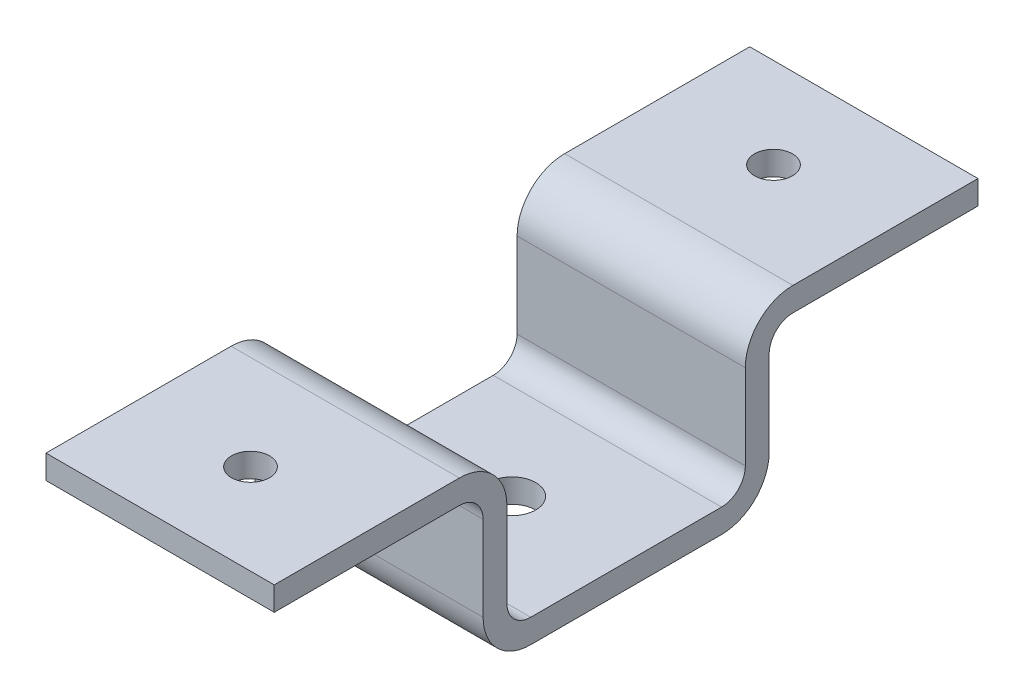
from build123d import *

# Parameters (mm, degrees)
BOSS_EXTRUDE3_START = -76.2
BOSS_EXTRUDE3_DEPTH = 76.2
SKETCH3_R           = 7.9375
CUT_EXTRUDE1_DEPTH  = 76.2
SKETCH2_R           = 6.35
CUT_EXTRUDE3_DEPTH  = 76.2


# Read off the part's stored shape, not the designer's step: Boss-Extrude3
with BuildPart() as part:
    # Boss-Extrude3 outline → Boss-Extrude3 (new body)
    with BuildSketch(Plane.YZ.offset(BOSS_EXTRUDE3_START)):
        with BuildLine():
            Line((44.228000004, 47.750520151), (15.875, 47.750520151))
            ThreePointArc((15.875, 47.750520151), (4.649679848, 43.100840303), (0, 31.875520151))
            Line((0, 31.875520151), (0, -31.875520151))
            ThreePointArc((0, -31.875520151), (4.649679849, -43.100840302), (15.875, -47.750520151))
            Line((15.875, -47.750520151), (44.228000004, -47.750520151))
            ThreePointArc((44.228000004, -47.750520151), (49.849640336, -50.079079819), (52.178200004, -55.700720151))
            Line((52.178200004, -55.700720151), (52.178200004, -117.475))
            Line((52.178200004, -117.475), (60.128400004, -117.475))
            Line((60.128400004, -117.475), (60.128400004, -55.675320151))
            ThreePointArc((60.128400004, -55.675320151), (55.478720155, -44.45), (44.253400004, -39.800320151))
            Line((44.253400004, -39.800320151), (15.9004, -39.800320151))
            ThreePointArc((15.9004, -39.800320151), (10.278759668, -37.471760483), (7.9502, -31.850120151))
            Line((7.9502, -31.850120151), (7.9502, 31.850120151))
            ThreePointArc((7.9502, 31.850120151), (10.278759668, 37.471760483), (15.9004, 39.800320151))
            Line((15.9004, 39.800320151), (44.253400004, 39.800320151))
            ThreePointArc((44.253400004, 39.800320151), (55.478720155, 44.45), (60.128400004, 55.675320151))
            Line((60.128400004, 55.675320151), (60.128400004, 117.475))
            Line((60.128400004, 117.475), (52.178200004, 117.475))
            Line((52.178200004, 117.475), (52.178200004, 55.700720151))
            ThreePointArc((52.178200004, 55.700720151), (49.849640335, 50.079079819), (44.228000004, 47.750520151))
        make_face()
    extrude(amount=BOSS_EXTRUDE3_DEPTH)

    # Sketch3 → Cut-Extrude1 (cut)
    with BuildSketch(Plane(origin=(0, 7.9502, 0), x_dir=(1, 0, 0), z_dir=(0, 1, 0))):
        with Locations(Location((-38.1, 0, 0), (0, 0, 270))):
            Circle(SKETCH3_R)
    extrude(amount=-CUT_EXTRUDE1_DEPTH, mode=Mode.SUBTRACT)

    # Sketch2 → Cut-Extrude3 (cut)
    with BuildSketch(Plane(origin=(0, 60.128400004, 0), x_dir=(1, 0, 0), z_dir=(0, 1, 0))):
        with Locations(Location((-38.1, 87.2998, 0), (0, 0, 270))):
            Circle(SKETCH2_R)
        with Locations(Location((-38.1, -87.2998, 0), (0, 0, 270))):
            Circle(SKETCH2_R)
    extrude(amount=-CUT_EXTRUDE3_DEPTH, mode=Mode.SUBTRACT)


solid = part.part
